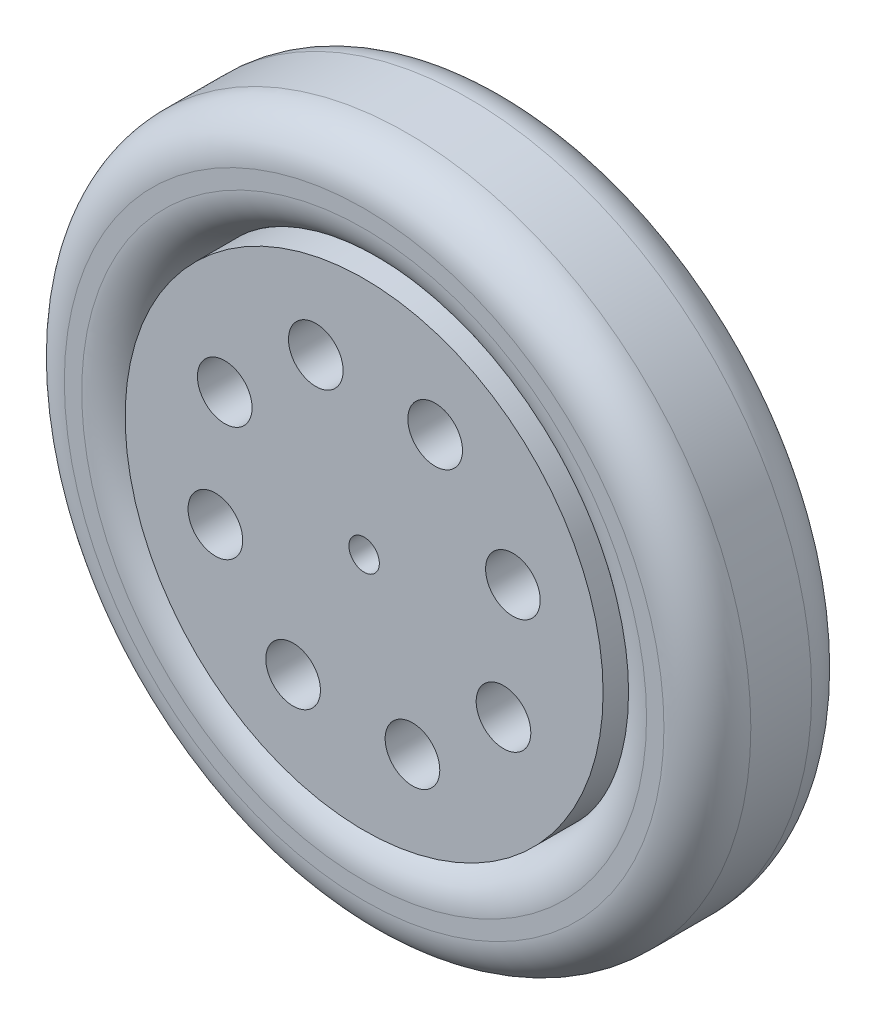
from build123d import *

# Parameters (mm, degrees)
SKETCH1_R           = 79
SKETCH1_R_2         = 55
BOSS_EXTRUDE1_DEPTH = 34
FILLET1_R           = 10
SKETCH2_R           = 55
SKETCH2_R_2         = 6.28765786
SKETCH2_R_3         = 3.5
BOSS_EXTRUDE2_DEPTH = 34
SKETCH4_R           = 12.7
BOSS_EXTRUDE3_DEPTH = 2
FILLET2_R           = 10
FILLET3_R           = 5


with BuildPart() as part:
    # Sketch1 → Boss-Extrude1 (new body)
    with BuildSketch(Plane.XY):
        Circle(SKETCH1_R)
        Circle(SKETCH1_R_2, mode=Mode.SUBTRACT)
    extrude(amount=BOSS_EXTRUDE1_DEPTH)

    # Fillet1
    fillet1_edges = [part.edges().sort_by_distance(p)[0] for p in [
        (-79, 0, 0),
        (-79, 0, 34),
        (-55, 0, 0),
        (-55, 0, 34),
    ]]
    fillet(fillet1_edges, radius=FILLET1_R)

    # Sketch2 → Boss-Extrude2 (add)
    with BuildSketch(Plane.XY):
        Circle(SKETCH2_R)
        with Locations((-11.124611797, 34.238034587)):
            Circle(SKETCH2_R_2, mode=Mode.SUBTRACT)
        with Locations((16.343657991, 32.076234871)):
            Circle(SKETCH2_R_2, mode=Mode.SUBTRACT)
        with Locations((34.238034587, 11.124611798)):
            Circle(SKETCH2_R_2, mode=Mode.SUBTRACT)
        with Locations((32.076234871, -16.343657991)):
            Circle(SKETCH2_R_2, mode=Mode.SUBTRACT)
        with Locations((11.124611798, -34.238034587)):
            Circle(SKETCH2_R_2, mode=Mode.SUBTRACT)
        with Locations((-16.343657991, -32.076234871)):
            Circle(SKETCH2_R_2, mode=Mode.SUBTRACT)
        with Locations((-34.238034587, -11.124611798)):
            Circle(SKETCH2_R_2, mode=Mode.SUBTRACT)
        with Locations((-32.076234871, 16.343657991)):
            Circle(SKETCH2_R_2, mode=Mode.SUBTRACT)
        Circle(SKETCH2_R_3, mode=Mode.SUBTRACT)
    extrude(amount=BOSS_EXTRUDE2_DEPTH)

    # Sketch4 → Boss-Extrude3 (add)
    with BuildSketch(Plane(origin=(0, 0, 0), x_dir=(-1, 0, 0), z_dir=(0, 0, -1))):
        with Locations(Location((0, 0, 0), (0, 0, 180))):
            Circle(SKETCH4_R)
    extrude(amount=BOSS_EXTRUDE3_DEPTH)

    # Fillet2
    # the kernel refuses this fillet: 10 mm, written as the material it takes off along each edge
    with BuildSketch(Plane(origin=(0, 0, -2), x_dir=(1, 0, 0), z_dir=(0, 1, 0))) as fillet2_piece_1:
        with BuildLine():
            CenterArc((6.7, -10), FILLET2_R, 53.130102354, 36.869897646)
            Line((6.7, 0), (6.7, 0.2))
            Line((6.7, 0.2), (12.7, 0.2))
            Line((12.7, 0.2), (12.9, 0))
            ThreePointArc((12.9, 0), (12.9, -1), (12.82, -1.84))
            Line((12.82, -1.84), (12.7, -2))
        make_face()
    revolve(axis=Axis((0, 0, -2), (0, 0, -1)), mode=Mode.SUBTRACT)

    # Fillet3
    fillet3_edges = [part.edges().sort_by_distance(p)[0] for p in [
        (-55, 0, 0),
    ]]
    fillet(fillet3_edges, radius=FILLET3_R)


solid = part.part
